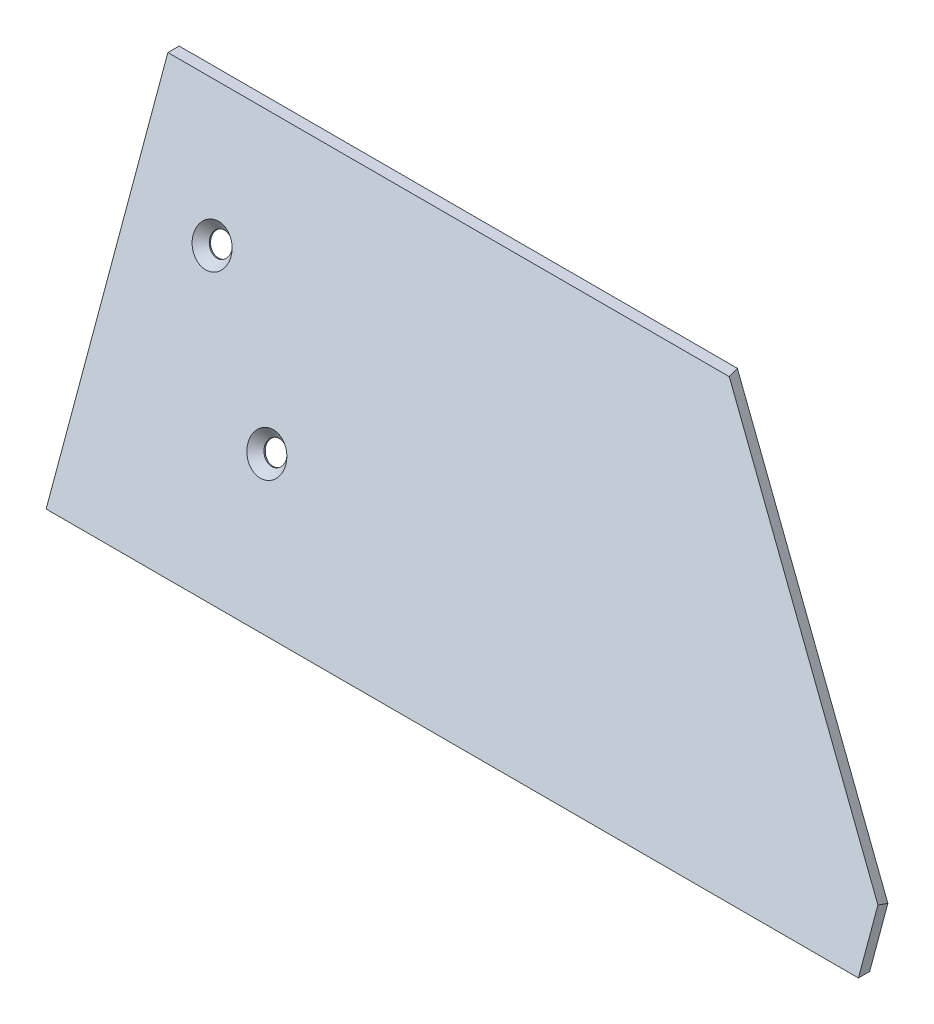
from build123d import *

# Parameters (mm, degrees)
MAIN_DEPTH                   = 85
BACKBRACKETHOLES_D           = 4.572
BACKBRACKETHOLES_DEPTH       = 5
BACKBRACKETHOLES_CSINK_D     = 7.9248
BACKBRACKETHOLES_CSINK_ANGLE = 82
FRONT_CUT_REACH              = 115.044


with BuildPart() as part:
    # Sketch1 → Main (new, symmetric)
    with BuildSketch(Plane(origin=(0, 0, 0), x_dir=(0, 0, -1), z_dir=(1, 0, 0))):
        Polygon((0, 0), (-2.3622, 0), (23.115716399, 70), (25.477916399, 70), align=None)
    extrude(amount=MAIN_DEPTH, both=True)

    # BackBracketHoles
    with Locations(Plane(origin=(0, 0.759196446, 2.085875092), x_dir=(1, 0, 0), z_dir=(0, 0.3420201433256726, 0.9396926207859071))):
        with Locations((-67.6378, 50.002080017), (-47.6378, 25.002080017)):
            CounterSinkHole(BACKBRACKETHOLES_D / 2, BACKBRACKETHOLES_CSINK_D / 2, depth=BACKBRACKETHOLES_DEPTH, counter_sink_angle=BACKBRACKETHOLES_CSINK_ANGLE)

    # Sketch4 → Front Cut (cut, up to next)
    with BuildSketch(Plane(origin=(0, 0.759196446, 2.085875092), x_dir=(1, 0, 0), z_dir=(0, 0.3420201433256726, 0.9396926207859071)), mode=Mode.PRIVATE) as front_cut_sk1:
        Polygon((95, -0.807919983), (95, 74.492444073), (31.815492293, 74.492444073), align=None)
    front_cut_tool1 = extrude(front_cut_sk1.sketch, amount=-FRONT_CUT_REACH, mode=Mode.PRIVATE) & part.part
    add(front_cut_tool1.solids().sort_by_distance((73.938497, 47.172798, -14.807294))[0], mode=Mode.SUBTRACT)


solid = part.part
